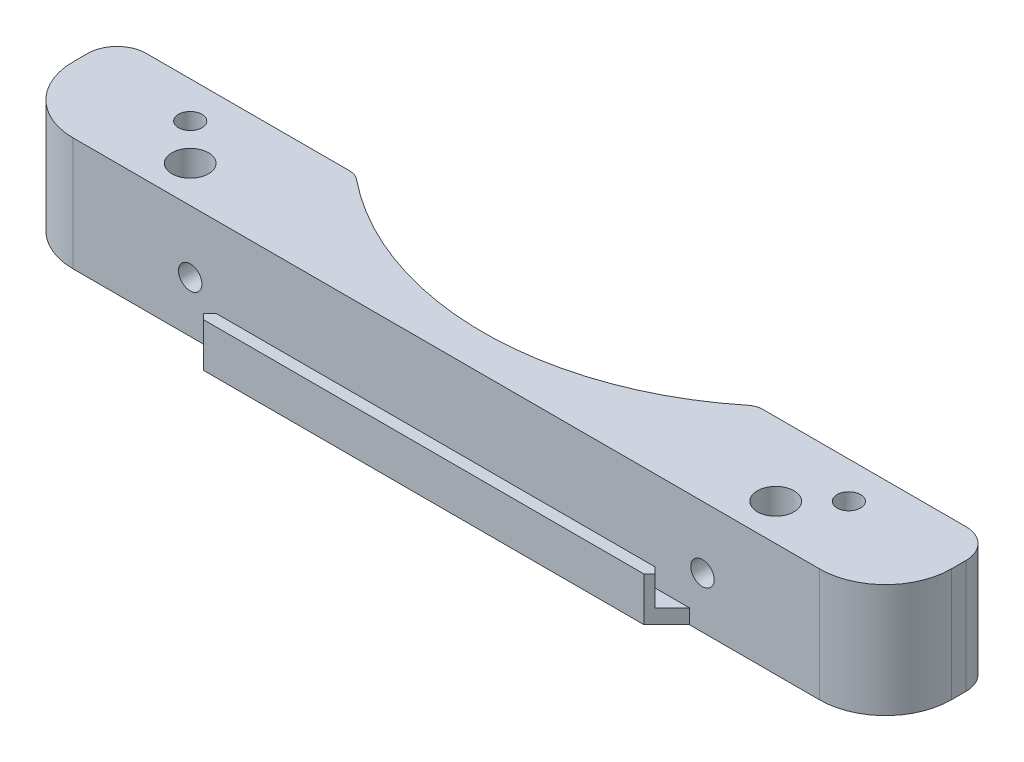
from build123d import *
from OCP.BRepFilletAPI import BRepFilletAPI_MakeChamfer, BRepFilletAPI_MakeFillet

# Parameters (mm, degrees)
BOSS_EXTRU_1_DEPTH      = 15.5
BOSS_EXTRU_2_DEPTH      = 30
ESQUISSE2_R             = 1.6
ENL_V_MAT_EXTRU_1_DEPTH = 63.869786066
ESQUISSE3_R             = 2
ENL_V_MAT_EXTRU_2_DEPTH = 13
ESQUISSE9_R             = 2.5
ENL_V_MAT_EXTRU_7_DEPTH = 7
ENL_V_MAT_EXTRU_3_REACH = 64.87
ESQUISSE5_R             = 1.6
ESQUISSE6_R             = 2.1
ENL_V_MAT_EXTRU_4_DEPTH = 13
ESQUISSE10_R            = 2.5
ENL_V_MAT_EXTRU_8_DEPTH = 7
ENL_V_MAT_EXTRU_5_REACH = 65.759
ESQUISSE7_R             = 1.6
ESQUISSE8_R             = 2
ENL_V_MAT_EXTRU_6_DEPTH = 12.5
ESQUISSE11_R            = 2.5
ENL_V_MAT_EXTRU_9_DEPTH = 6.5
CONG_1_R1               = 2.5
CONG_1_R2               = 4
CONG_1_R3               = 9
CHANFREIN1_SIZE         = 3.2
CHANFREIN2_SIZE         = 1.2
CHANFREIN2_SIZE2        = 1.697056275


with BuildPart() as part:
    # Esquisse1 → Boss.-Extru.1 (new body)
    with BuildSketch(Plane(origin=(0, 0, 0), x_dir=(1, 0, 0), z_dir=(0, 1, 0))):
        with BuildLine():
            Line((-27.386127875, 7.5), (-60, 7.5))
            Line((-60, 7.5), (-60, -7.5))
            Line((-60, -7.5), (60, -7.5))
            Line((60, -7.5), (60, 7.5))
            Line((60, 7.5), (27.386127875, 7.5))
            ThreePointArc((27.386127875, 7.5), (0, -2.5), (-27.386127875, 7.5))
        make_face()
    extrude(amount=BOSS_EXTRU_1_DEPTH)

    # Esquisse12 → Boss.-Extru.2 (add, symmetric)
    with BuildSketch(Plane(origin=(0, 0, 0), x_dir=(0, 0, -1), z_dir=(1, 0, 0))):
        Polygon((-7.5, 0), (-10.6, 0), (-10.6, 6), (-9, 6), (-9, 2), (-7.5, 2), align=None)
    extrude(amount=BOSS_EXTRU_2_DEPTH, both=True)

    # Esquisse2 → Enlèv. mat.-Extru.1 (cut, through all)
    with BuildSketch(Plane(origin=(0, 15.5, 0), x_dir=(1, 0, 0), z_dir=(0, 1, 0))):
        with Locations(Location((45, 2.5, 0), (0, 0, 270))):
            Circle(ESQUISSE2_R)
    enl_v_mat_extru_1 = extrude(amount=-ENL_V_MAT_EXTRU_1_DEPTH, mode=Mode.SUBTRACT)

    # Esquisse3 → Enlèv. mat.-Extru.2 (cut)
    with BuildSketch(Plane.XZ):
        with Locations(Location((45, -2.5, 0), (0, 0, 270))):
            Circle(ESQUISSE3_R)
    enl_v_mat_extru_2 = extrude(amount=-ENL_V_MAT_EXTRU_2_DEPTH, mode=Mode.SUBTRACT)

    # Esquisse9 → Enlèv. mat.-Extru.7 (cut)
    with BuildSketch(Plane.XZ):
        with Locations(Location((45, -2.5, 0), (0, 0, 270))):
            Circle(ESQUISSE9_R)
    enl_v_mat_extru_7 = extrude(amount=-ENL_V_MAT_EXTRU_7_DEPTH, mode=Mode.SUBTRACT)

    # Esquisse5 → Enlèv. mat.-Extru.3 (cut, up to next)
    with BuildSketch(Plane.XZ, mode=Mode.PRIVATE) as enl_v_mat_extru_3_sk1:
        with Locations(Location((40, 2.5, 0), (0, 0, 270))):
            Circle(ESQUISSE5_R)
    enl_v_mat_extru_3_tool1 = extrude(enl_v_mat_extru_3_sk1.sketch, amount=-ENL_V_MAT_EXTRU_3_REACH, mode=Mode.PRIVATE) & part.part
    enl_v_mat_extru_3 = enl_v_mat_extru_3_tool1.solids().sort_by_distance((40, 0, 2.5))[0]
    add(enl_v_mat_extru_3, mode=Mode.SUBTRACT)

    # Esquisse6 → Enlèv. mat.-Extru.4 (cut)
    with BuildSketch(Plane(origin=(0, 15.5, 0), x_dir=(1, 0, 0), z_dir=(0, 1, 0))):
        with Locations(Location((40, -2.5, 0), (0, 0, 270))):
            Circle(ESQUISSE6_R)
    enl_v_mat_extru_4 = extrude(amount=-ENL_V_MAT_EXTRU_4_DEPTH, mode=Mode.SUBTRACT)

    # Esquisse10 → Enlèv. mat.-Extru.8 (cut)
    with BuildSketch(Plane(origin=(0, 15.5, 0), x_dir=(1, 0, 0), z_dir=(0, 1, 0))):
        with Locations(Location((40, -2.5, 0), (0, 0, 270))):
            Circle(ESQUISSE10_R)
    enl_v_mat_extru_8 = extrude(amount=-ENL_V_MAT_EXTRU_8_DEPTH, mode=Mode.SUBTRACT)

    # Esquisse7 → Enlèv. mat.-Extru.5 (cut, up to next)
    with BuildSketch(Plane.XY.offset(7.5), mode=Mode.PRIVATE) as enl_v_mat_extru_5_sk1:
        with Locations((35, 7)):
            Circle(ESQUISSE7_R)
    enl_v_mat_extru_5_tool1 = extrude(enl_v_mat_extru_5_sk1.sketch, amount=-ENL_V_MAT_EXTRU_5_REACH, mode=Mode.PRIVATE) & part.part
    enl_v_mat_extru_5 = enl_v_mat_extru_5_tool1.solids().sort_by_distance((35, 7, 7.5))[0]
    add(enl_v_mat_extru_5, mode=Mode.SUBTRACT)

    # Esquisse8 → Enlèv. mat.-Extru.6 (cut)
    with BuildSketch(Plane(origin=(0, 0, -7.5), x_dir=(-1, 0, 0), z_dir=(0, 0, -1))):
        with Locations((-35, 7)):
            Circle(ESQUISSE8_R)
    enl_v_mat_extru_6 = extrude(amount=-ENL_V_MAT_EXTRU_6_DEPTH, mode=Mode.SUBTRACT)

    # Esquisse11 → Enlèv. mat.-Extru.9 (cut)
    with BuildSketch(Plane(origin=(0, 0, -7.5), x_dir=(-1, 0, 0), z_dir=(0, 0, -1))):
        with Locations((-35, 7)):
            Circle(ESQUISSE11_R)
    enl_v_mat_extru_9 = extrude(amount=-ENL_V_MAT_EXTRU_9_DEPTH, mode=Mode.SUBTRACT)

    # Symétrie1: Enlèv. mat.-Extru.1, Enlèv. mat.-Extru.2, Enlèv. mat.-Extru.7, Enlèv. mat.-Extru.3, Enlèv. mat.-Extru.4, Enlèv. mat.-Extru.8, Enlèv. mat.-Extru.5, Enlèv. mat.-Extru.6, Enlèv. mat.-Extru.9 across plane
    add(enl_v_mat_extru_1.mirror(Plane(origin=(0, 0, 0), x_dir=(0, 0, 1), z_dir=(1, 0, 0))), mode=Mode.SUBTRACT)
    add(enl_v_mat_extru_2.mirror(Plane(origin=(0, 0, 0), x_dir=(0, 0, 1), z_dir=(1, 0, 0))), mode=Mode.SUBTRACT)
    add(enl_v_mat_extru_7.mirror(Plane(origin=(0, 0, 0), x_dir=(0, 0, 1), z_dir=(1, 0, 0))), mode=Mode.SUBTRACT)
    add(enl_v_mat_extru_3.mirror(Plane(origin=(0, 0, 0), x_dir=(0, 0, 1), z_dir=(1, 0, 0))), mode=Mode.SUBTRACT)
    add(enl_v_mat_extru_4.mirror(Plane(origin=(0, 0, 0), x_dir=(0, 0, 1), z_dir=(1, 0, 0))), mode=Mode.SUBTRACT)
    add(enl_v_mat_extru_8.mirror(Plane(origin=(0, 0, 0), x_dir=(0, 0, 1), z_dir=(1, 0, 0))), mode=Mode.SUBTRACT)
    add(enl_v_mat_extru_5.mirror(Plane(origin=(0, 0, 0), x_dir=(0, 0, 1), z_dir=(1, 0, 0))), mode=Mode.SUBTRACT)
    add(enl_v_mat_extru_6.mirror(Plane(origin=(0, 0, 0), x_dir=(0, 0, 1), z_dir=(1, 0, 0))), mode=Mode.SUBTRACT)
    add(enl_v_mat_extru_9.mirror(Plane(origin=(0, 0, 0), x_dir=(0, 0, 1), z_dir=(1, 0, 0))), mode=Mode.SUBTRACT)

    # Congé1: one fillet with a radius per group of edges: ONE call of the kernel's fillet builder (fillet() takes one radius for all edges)
    cong_1_edges_1 = [part.edges().sort_by_distance(p)[0] for p in [
        (27.386127875, 7.75, -7.5),
        (-27.386127875, 7.75, -7.5),
    ]]
    cong_1_edges_2 = [part.edges().sort_by_distance(p)[0] for p in [
        (60, 7.75, -7.5),
        (-60, 7.75, -7.5),
    ]]
    cong_1_edges_3 = [part.edges().sort_by_distance(p)[0] for p in [
        (60, 7.75, 7.5),
        (-60, 7.75, 7.5),
    ]]
    cong_1 = BRepFilletAPI_MakeFillet(part.part.solid().wrapped)
    for e in cong_1_edges_1:
        cong_1.Add(CONG_1_R1, e.wrapped)
    for e in cong_1_edges_2:
        cong_1.Add(CONG_1_R2, e.wrapped)
    for e in cong_1_edges_3:
        cong_1.Add(CONG_1_R3, e.wrapped)
    add(Compound.cast(cong_1.Shape()), mode=Mode.REPLACE)

    # Chanfrein1
    # the kernel refuses this chamfer: 3.2 mm, written as the material it adds along each edge
    with BuildSketch(Plane(origin=(30, 10.229385561, 7.5), x_dir=(0.9996219169112968, 0, -0.027495876610586226), z_dir=(0, -1, 0))) as chanfrein1_piece_1_section:
        Polygon((CHANFREIN1_SIZE * 0.999621916911, CHANFREIN1_SIZE * 0.0274958766106), (-CHANFREIN1_SIZE * 0.0274958766106, CHANFREIN1_SIZE * 0.999621916911), (0, 0), align=None)
    chanfrein1_piece_1 = extrude(amount=10.229385561, mode=Mode.PRIVATE)
    chanfrein1_piece_1 = split(chanfrein1_piece_1, bisect_by=Plane(origin=(30.510820254, 2, 9.595713626), z_dir=(0, 1, 0)), keep=Keep.TOP, mode=Mode.PRIVATE)
    chanfrein1_piece_1 = split(chanfrein1_piece_1, bisect_by=Plane(origin=(30.510820254, 4, 10.6), z_dir=(0, 0, -1)), keep=Keep.TOP, mode=Mode.PRIVATE)
    chanfrein1_piece_1 = split(chanfrein1_piece_1, bisect_by=Plane(origin=(30.510820254, 6, 9.595713626), z_dir=(0, -1, 0)), keep=Keep.TOP, mode=Mode.PRIVATE)
    chanfrein1_piece_1 = split(chanfrein1_piece_1, bisect_by=Plane(origin=(30.510820254, 4, 9), z_dir=(0, 0, 1)), keep=Keep.TOP, mode=Mode.PRIVATE)
    add(chanfrein1_piece_1)
    with BuildSketch(Plane(origin=(30, 2, 7.5), x_dir=(0.9996219169112966, 0, -0.02749587661058616), z_dir=(0, -1, 0))) as chanfrein1_piece_2_section:
        Polygon((CHANFREIN1_SIZE * 0.999621916911, CHANFREIN1_SIZE * 0.0274958766106), (-CHANFREIN1_SIZE * 0.0274958766106, CHANFREIN1_SIZE * 0.999621916911), (0, 0), align=None)
    chanfrein1_piece_2 = extrude(amount=2, mode=Mode.PRIVATE)
    chanfrein1_piece_2 = split(chanfrein1_piece_2, bisect_by=Plane(origin=(31.278670845, 1, 9), z_dir=(0, 0, -1)), keep=Keep.TOP, mode=Mode.PRIVATE)
    add(chanfrein1_piece_2)
    with BuildSketch(Plane(origin=(30, 2, 7.5), x_dir=(0.9996219169112966, 0, -0.02749587661058616), z_dir=(0, -1, 0))) as chanfrein1_piece_3_section:
        Polygon((CHANFREIN1_SIZE * 0.999621916911, CHANFREIN1_SIZE * 0.0274958766106), (-CHANFREIN1_SIZE * 0.0274958766106, CHANFREIN1_SIZE * 0.999621916911), (0, 0), align=None)
    chanfrein1_piece_3 = extrude(amount=2, mode=Mode.PRIVATE)
    chanfrein1_piece_3 = split(chanfrein1_piece_3, bisect_by=Plane(origin=(30.510820254, 1, 10.6), z_dir=(0, 0, -1)), keep=Keep.TOP, mode=Mode.PRIVATE)
    chanfrein1_piece_3 = split(chanfrein1_piece_3, bisect_by=Plane(origin=(30.510820254, 1, 9), z_dir=(0, 0, 1)), keep=Keep.TOP, mode=Mode.PRIVATE)
    add(chanfrein1_piece_3)
    with BuildSketch(Plane(origin=(-30, 10.229385561, 7.5), x_dir=(-0.9996219169112968, 0, -0.027495876610586226), z_dir=(0, -1, 0))) as chanfrein1_piece_4_section:
        Polygon((CHANFREIN1_SIZE * 0.999621916911, -CHANFREIN1_SIZE * 0.0274958766106), (-CHANFREIN1_SIZE * 0.0274958766106, -CHANFREIN1_SIZE * 0.999621916911), (0, 0), align=None)
    chanfrein1_piece_4 = extrude(amount=10.229385561, mode=Mode.PRIVATE)
    chanfrein1_piece_4 = split(chanfrein1_piece_4, bisect_by=Plane(origin=(-30.510820254, 2, 9.595713626), z_dir=(0, 1, 0)), keep=Keep.TOP, mode=Mode.PRIVATE)
    chanfrein1_piece_4 = split(chanfrein1_piece_4, bisect_by=Plane(origin=(-30.510820254, 4, 10.6), z_dir=(0, 0, -1)), keep=Keep.TOP, mode=Mode.PRIVATE)
    chanfrein1_piece_4 = split(chanfrein1_piece_4, bisect_by=Plane(origin=(-30.510820254, 6, 9.595713626), z_dir=(0, -1, 0)), keep=Keep.TOP, mode=Mode.PRIVATE)
    chanfrein1_piece_4 = split(chanfrein1_piece_4, bisect_by=Plane(origin=(-30.510820254, 4, 9), z_dir=(0, 0, 1)), keep=Keep.TOP, mode=Mode.PRIVATE)
    add(chanfrein1_piece_4)
    with BuildSketch(Plane(origin=(-30, 2, 7.5), x_dir=(-0.9996219169112968, 0, -0.027495876610586226), z_dir=(0, -1, 0))) as chanfrein1_piece_5_section:
        Polygon((CHANFREIN1_SIZE * 0.999621916911, -CHANFREIN1_SIZE * 0.0274958766106), (-CHANFREIN1_SIZE * 0.0274958766106, -CHANFREIN1_SIZE * 0.999621916911), (0, 0), align=None)
    chanfrein1_piece_5 = extrude(amount=2, mode=Mode.PRIVATE)
    chanfrein1_piece_5 = split(chanfrein1_piece_5, bisect_by=Plane(origin=(-31.278670845, 1, 9), z_dir=(0, 0, -1)), keep=Keep.TOP, mode=Mode.PRIVATE)
    add(chanfrein1_piece_5)
    with BuildSketch(Plane(origin=(-30, 2, 7.5), x_dir=(-0.9996219169112968, 0, -0.027495876610586226), z_dir=(0, -1, 0))) as chanfrein1_piece_6_section:
        Polygon((CHANFREIN1_SIZE * 0.999621916911, -CHANFREIN1_SIZE * 0.0274958766106), (-CHANFREIN1_SIZE * 0.0274958766106, -CHANFREIN1_SIZE * 0.999621916911), (0, 0), align=None)
    chanfrein1_piece_6 = extrude(amount=2, mode=Mode.PRIVATE)
    chanfrein1_piece_6 = split(chanfrein1_piece_6, bisect_by=Plane(origin=(-30.510820254, 1, 10.6), z_dir=(0, 0, -1)), keep=Keep.TOP, mode=Mode.PRIVATE)
    chanfrein1_piece_6 = split(chanfrein1_piece_6, bisect_by=Plane(origin=(-30.510820254, 1, 9), z_dir=(0, 0, 1)), keep=Keep.TOP, mode=Mode.PRIVATE)
    add(chanfrein1_piece_6)

    # Chanfrein2: one chamfer whose edges measure the first distance from different faces: ONE call of the kernel's chamfer builder (chamfer() names one face for all edges)
    chanfrein2_edges_1 = [part.edges().sort_by_distance(p)[0] for p in [
        (31.7, 4, 9),
    ]]
    chanfrein2_side_1 = [part.faces().sort_by_distance(p)[0] for p in [
        (31.269047619, 2.523809524, 9.430952381),
    ]]
    chanfrein2_edges_2 = [part.edges().sort_by_distance(p)[0] for p in [
        (-31.7, 4, 9),
    ]]
    chanfrein2_side_2 = [part.faces().sort_by_distance(p)[0] for p in [
        (-31.269047619, 2.523809524, 9.430952381),
    ]]
    chanfrein2 = BRepFilletAPI_MakeChamfer(part.part.solid().wrapped)
    for e in chanfrein2_edges_1:
        chanfrein2.Add(CHANFREIN2_SIZE, CHANFREIN2_SIZE2, e.wrapped, chanfrein2_side_1[0].wrapped)  # the first distance lies on this face
    for e in chanfrein2_edges_2:
        chanfrein2.Add(CHANFREIN2_SIZE, CHANFREIN2_SIZE2, e.wrapped, chanfrein2_side_2[0].wrapped)  # the first distance lies on this face
    add(Compound.cast(chanfrein2.Shape()), mode=Mode.REPLACE)


solid = part.part
